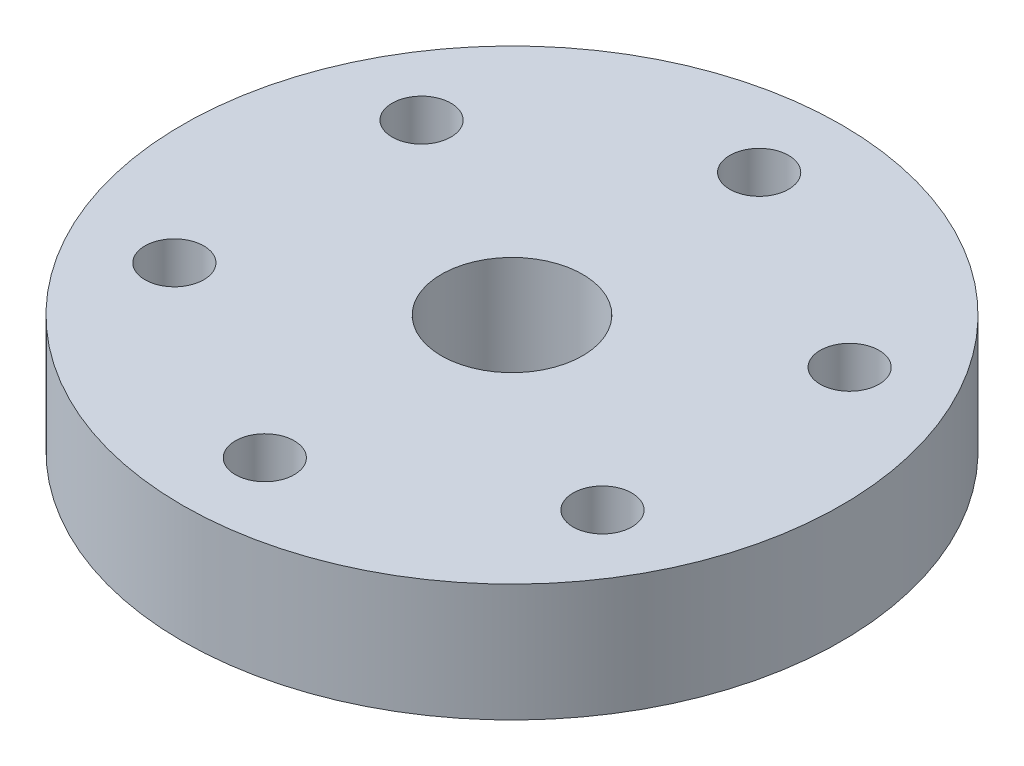
from build123d import *

# Parameters (mm, degrees)
SKETCH1_R           = 28
SKETCH1_R_2         = 2.5
SKETCH1_R_3         = 6
BOSS_EXTRUDE1_DEPTH = 10


with BuildPart() as part:
    # Sketch1 → Boss-Extrude1 (new body)
    with BuildSketch(Plane(origin=(0, 0, 0), x_dir=(1, 0, 0), z_dir=(0, 1, 0))):
        Circle(SKETCH1_R)
        with Locations((0, 21)):
            Circle(SKETCH1_R_2, mode=Mode.SUBTRACT)
        with Locations((18.186533479, 10.5)):
            Circle(SKETCH1_R_2, mode=Mode.SUBTRACT)
        with Locations((18.186533479, -10.5)):
            Circle(SKETCH1_R_2, mode=Mode.SUBTRACT)
        with Locations((0, -21)):
            Circle(SKETCH1_R_2, mode=Mode.SUBTRACT)
        with Locations((-18.186533479, -10.5)):
            Circle(SKETCH1_R_2, mode=Mode.SUBTRACT)
        with Locations((-18.186533479, 10.5)):
            Circle(SKETCH1_R_2, mode=Mode.SUBTRACT)
        Circle(SKETCH1_R_3, mode=Mode.SUBTRACT)
    extrude(amount=BOSS_EXTRUDE1_DEPTH)


solid = part.part
